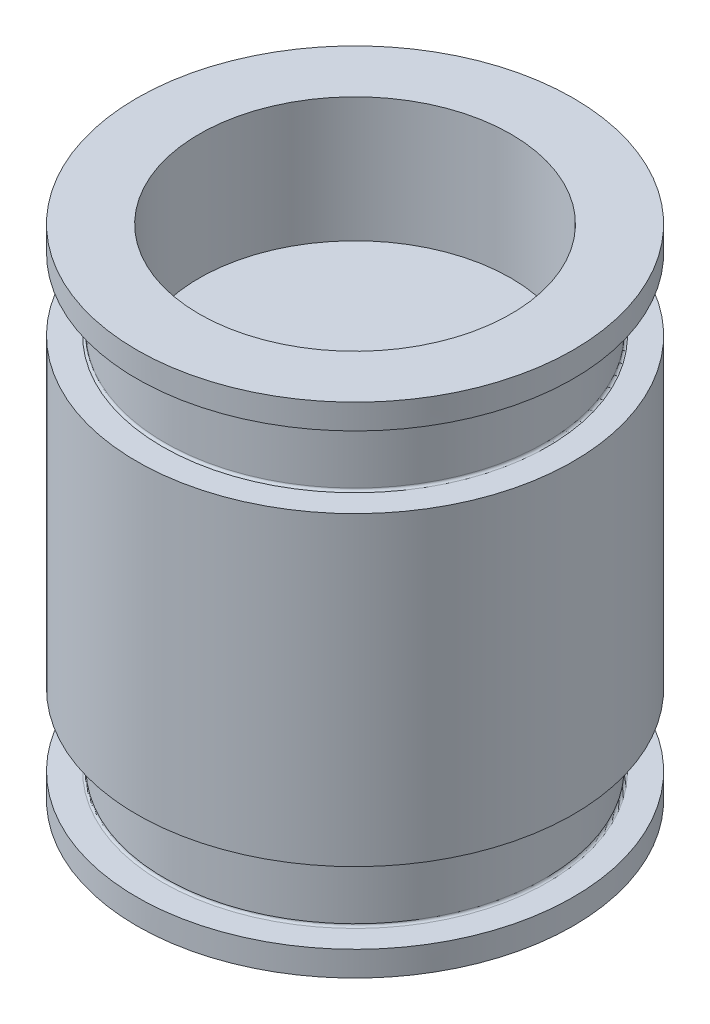
from build123d import *

# Parameters (mm, degrees)
SKETCH1_R             = 22.225
BOSS_EXTRUDE1_DEPTH   = 25.4
SKETCH2_R             = 15.875
LIGHTENING_HOLE_DEPTH = 12.7


with BuildPart() as part:
    # Sketch1 → Boss-Extrude1 (new, symmetric)
    with BuildSketch(Plane(origin=(0, 0, 0), x_dir=(1, 0, 0), z_dir=(0, 1, 0))):
        Circle(SKETCH1_R)
    extrude(amount=BOSS_EXTRUDE1_DEPTH, both=True)

    # Sketch2 → lightening hole (cut)
    with BuildSketch(Plane(origin=(0, 25.4, 0), x_dir=(1, 0, 0), z_dir=(0, 1, 0))):
        Circle(SKETCH2_R)
    lightening_hole = extrude(amount=-LIGHTENING_HOLE_DEPTH, mode=Mode.SUBTRACT)

    # main-o-ring → o-ring-main (with backup rings) (revolve, cut)
    with BuildSketch(Plane.XY):
        with BuildLine():
            Line((-22.225, 22.86), (-22.225, 15.5702))
            Line((-22.225, 15.5702), (-19.620412385, 15.5702))
            ThreePointArc((-19.620412385, 15.5702), (-19.450556579, 15.640556579), (-19.3802, 15.810412385))
            Line((-19.3802, 15.810412385), (-19.3802, 22.619787615))
            ThreePointArc((-19.3802, 22.619787615), (-19.450556579, 22.789643421), (-19.620412385, 22.86))
            Line((-19.620412385, 22.86), (-22.225, 22.86))
        make_face()
    o_ring_main_with_backup_rings = revolve(axis=Axis((0, 0, 0), (0, 1, 0)), mode=Mode.SUBTRACT)

    # Mirror1: lightening hole, o-ring-main (with backup rings) across plane
    add(lightening_hole.mirror(Plane.ZX), mode=Mode.SUBTRACT)
    add(o_ring_main_with_backup_rings.mirror(Plane.ZX), mode=Mode.SUBTRACT)


solid = part.part
